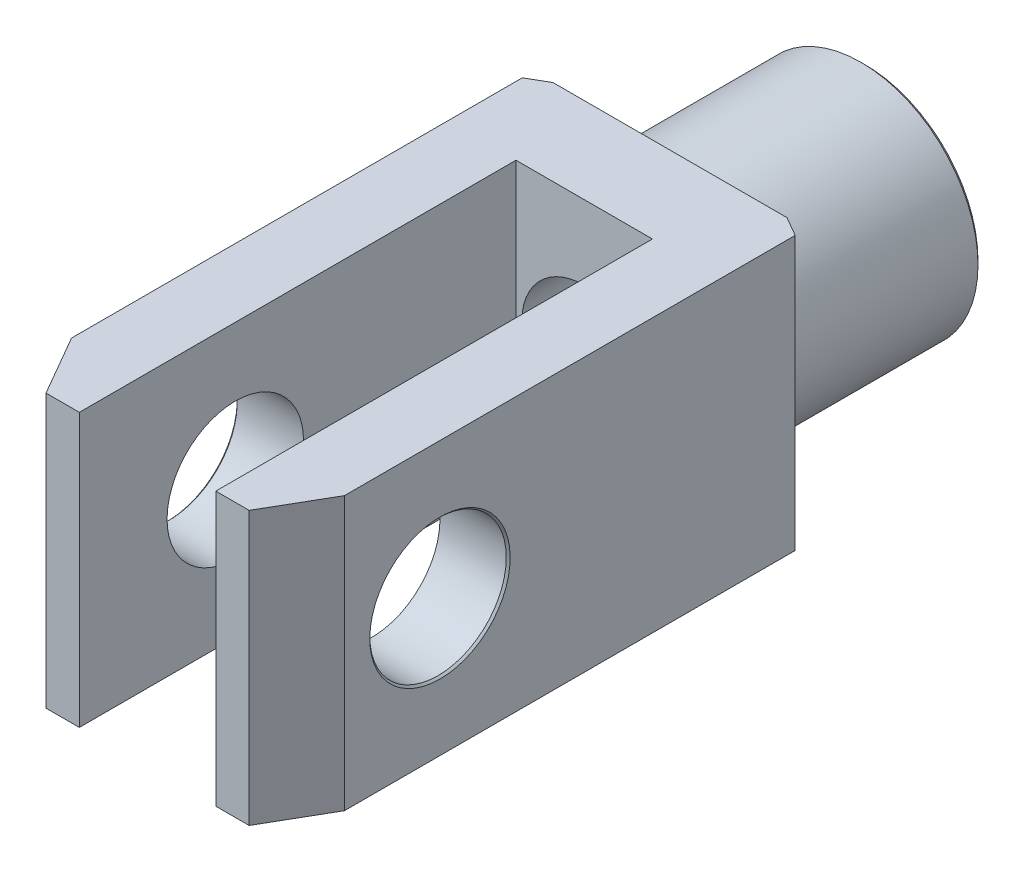
from build123d import *
from OCP.BRepFilletAPI import BRepFilletAPI_MakeChamfer

# Parameters (mm, degrees)
SKETCH2_R           = 30
BOSS_EXTRUDE1_DEPTH = 50
SKETCH3_W           = 70
SKETCH3_H           = 70
BOSS_EXTRUDE2_DEPTH = 134
SKETCH4_W           = 35
SKETCH4_H           = 70
CUT_EXTRUDE1_DEPTH  = 112
SKETCH5_R           = 16
CUT_EXTRUDE2_DEPTH  = 72
CHAMFER1_SIZE       = 15.5
CHAMFER1_SIZE2      = 8.948929172
SKETCH6_R           = 17.5
CUT_EXTRUDE3_DEPTH  = 70
CHAMFER2_SIZE       = 0.5
CHAMFER4_SIZE       = 1
CHAMFER6_SIZE       = 2
CHAMFER7_SIZE       = 5
CHAMFER7_SIZE_2     = 2.886751346


with BuildPart() as part:
    # Sketch2 → Boss-Extrude1 (new body)
    with BuildSketch(Plane.XY):
        Circle(SKETCH2_R)
    extrude(amount=BOSS_EXTRUDE1_DEPTH)

    # Sketch3 → Boss-Extrude2 (add)
    with BuildSketch(Plane.XY.offset(50)):
        Rectangle(SKETCH3_W, SKETCH3_H)
    extrude(amount=BOSS_EXTRUDE2_DEPTH)

    # Sketch4 → Cut-Extrude1 (cut)
    with BuildSketch(Plane.XY.offset(184)):
        Rectangle(SKETCH4_W, SKETCH4_H)
    extrude(amount=-CUT_EXTRUDE1_DEPTH, mode=Mode.SUBTRACT)

    # Sketch5 → Cut-Extrude2 (cut)
    with BuildSketch(Plane(origin=(0, 0, 0), x_dir=(-1, 0, 0), z_dir=(0, 0, -1))):
        Circle(SKETCH5_R)
    extrude(amount=-CUT_EXTRUDE2_DEPTH, mode=Mode.SUBTRACT)

    # Chamfer1: one chamfer whose edges measure the first distance from different faces: ONE call of the kernel's chamfer builder (chamfer() names one face for all edges)
    chamfer1_edges_1 = [part.edges().sort_by_distance(p)[0] for p in [
        (-35, 0, 184),
    ]]
    chamfer1_side_1 = [part.faces().sort_by_distance(p)[0] for p in [
        (-35, 0, 117),
    ]]
    chamfer1_edges_2 = [part.edges().sort_by_distance(p)[0] for p in [
        (35, 0, 184),
    ]]
    chamfer1_side_2 = [part.faces().sort_by_distance(p)[0] for p in [
        (35, 0, 117),
    ]]
    chamfer1 = BRepFilletAPI_MakeChamfer(part.part.solid().wrapped)
    for e in chamfer1_edges_1:
        chamfer1.Add(CHAMFER1_SIZE, CHAMFER1_SIZE2, e.wrapped, chamfer1_side_1[0].wrapped)  # the first distance lies on this face
    for e in chamfer1_edges_2:
        chamfer1.Add(CHAMFER1_SIZE, CHAMFER1_SIZE2, e.wrapped, chamfer1_side_2[0].wrapped)  # the first distance lies on this face
    add(Compound.cast(chamfer1.Shape()), mode=Mode.REPLACE)

    # Sketch6 → Cut-Extrude3 (cut)
    with BuildSketch(Plane(origin=(35, 0, 0), x_dir=(0, 0, -1), z_dir=(1, 0, 0))):
        with Locations(Location((-144, 0, 0), (0, 0, 90))):
            Circle(SKETCH6_R)
    extrude(amount=-CUT_EXTRUDE3_DEPTH, mode=Mode.SUBTRACT)

    # Chamfer2
    chamfer2_edges = [part.edges().sort_by_distance(p)[0] for p in [
        (-35, -17.5, 144),
        (35, -17.5, 144),
    ]]
    chamfer(chamfer2_edges, length=CHAMFER2_SIZE)

    # Chamfer4
    chamfer4_edges = [part.edges().sort_by_distance(p)[0] for p in [
        (-30, 0, 0),
    ]]
    chamfer(chamfer4_edges, length=CHAMFER4_SIZE)

    # Chamfer6
    chamfer6_edges = [part.edges().sort_by_distance(p)[0] for p in [
        (16, 0, 0),
    ]]
    chamfer(chamfer6_edges, length=CHAMFER6_SIZE)

    # Chamfer7
    chamfer7_edges_1 = [part.edges().sort_by_distance(p)[0] for p in [
        (-35, 0, 50),
    ]]
    chamfer7_side_1 = [part.faces().sort_by_distance(p)[0] for p in [
        (-34.942264973, 0, 50),
    ]]
    chamfer7_edges_2 = [part.edges().sort_by_distance(p)[0] for p in [
        (35, 0, 50),
    ]]
    chamfer7_side_2 = [part.faces().sort_by_distance(p)[0] for p in [
        (34.942264973, 0, 50),
    ]]
    chamfer7 = BRepFilletAPI_MakeChamfer(part.part.solid().wrapped)
    for e in chamfer7_edges_1:
        chamfer7.Add(CHAMFER7_SIZE - 0.0001, CHAMFER7_SIZE_2 - 0.0001, e.wrapped, chamfer7_side_1[0].wrapped)
    for e in chamfer7_edges_2:
        chamfer7.Add(CHAMFER7_SIZE - 0.0001, CHAMFER7_SIZE_2 - 0.0001, e.wrapped, chamfer7_side_2[0].wrapped)
    add(Compound.cast(chamfer7.Shape()), mode=Mode.REPLACE)  # a hair under: the kernel refuses the full size


solid = part.part
